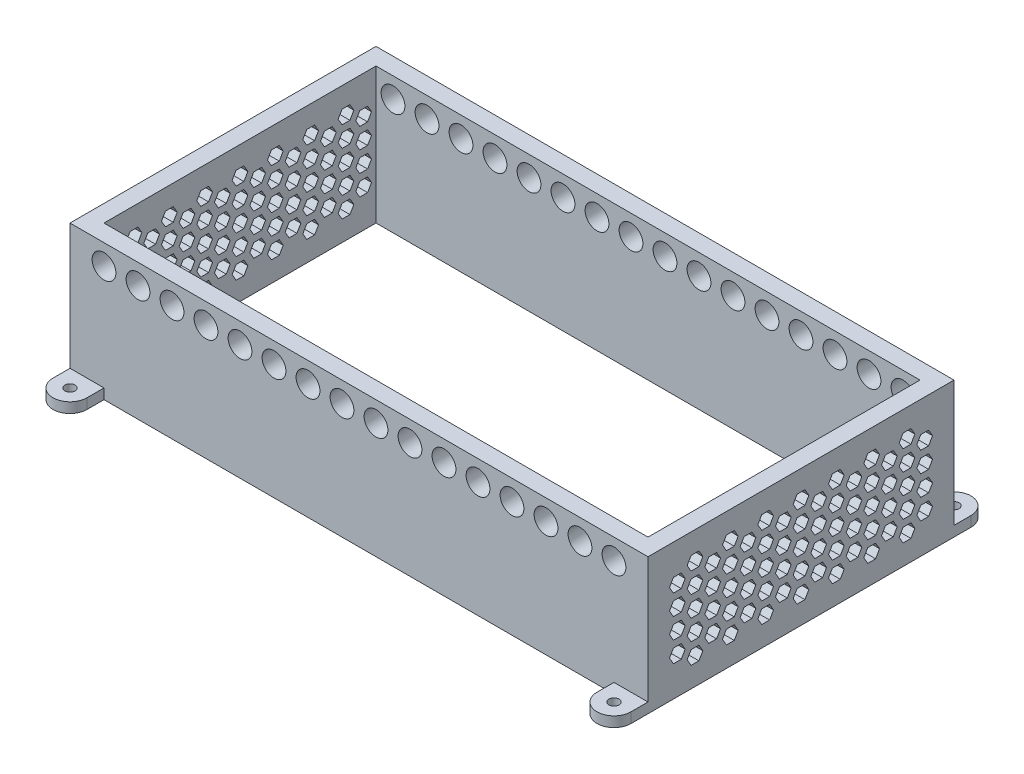
from build123d import *

# Parameters (mm, degrees)
SKETCH1_W           = 170
SKETCH1_H           = 90
BOSS_EXTRUDE1_DEPTH = 40
SHELL1_T            = -5
SKETCH2_R           = 3.5
CUT_EXTRUDE1_DEPTH  = 100
FILL_START          = -85
FILL_PATTERN1_DEPTH = 170
SKETCH4_R           = 5
SKETCH4_W           = 10
SKETCH4_H           = 10
BOSS_EXTRUDE2_DEPTH = 3
SKETCH5_R           = 1.5
CUT_EXTRUDE2_DEPTH  = 4


# Read off the part's stored shape, not the designer's step: Fill Pattern1
with BuildPart() as part:
    # Sketch1 → Boss-Extrude1 (new body)
    with BuildSketch(Plane(origin=(0, 0, 0), x_dir=(1, 0, 0), z_dir=(0, 1, 0))):
        Rectangle(SKETCH1_W, SKETCH1_H)
    extrude(amount=BOSS_EXTRUDE1_DEPTH)

    # Shell1
    shell1_openings = [part.faces().sort_by_distance(p)[0] for p in [
        (0, 40, 0),
        (0, 0, 0),
    ]]
    offset(amount=SHELL1_T, openings=shell1_openings, kind=Kind.INTERSECTION)

    # Sketch2 → Cut-Extrude1 (cut)
    with BuildSketch(Plane.XY.offset(45)):
        with Locations((-75, 34)):
            Circle(SKETCH2_R)
        with Locations((-65, 34)):
            Circle(SKETCH2_R)
        with Locations((-55, 34)):
            Circle(SKETCH2_R)
        with Locations((-45, 34)):
            Circle(SKETCH2_R)
        with Locations((-35, 34)):
            Circle(SKETCH2_R)
        with Locations((-25, 34)):
            Circle(SKETCH2_R)
        with Locations((-15, 34)):
            Circle(SKETCH2_R)
        with Locations((-5, 34)):
            Circle(SKETCH2_R)
        with Locations((5, 34)):
            Circle(SKETCH2_R)
        with Locations((15, 34)):
            Circle(SKETCH2_R)
        with Locations((25, 34)):
            Circle(SKETCH2_R)
        with Locations((35, 34)):
            Circle(SKETCH2_R)
        with Locations((45, 34)):
            Circle(SKETCH2_R)
        with Locations((55, 34)):
            Circle(SKETCH2_R)
        with Locations((65, 34)):
            Circle(SKETCH2_R)
        with Locations((75, 34)):
            Circle(SKETCH2_R)
    extrude(amount=-CUT_EXTRUDE1_DEPTH, mode=Mode.SUBTRACT)

    # Fill Pattern1 outline → Fill Pattern1 (cut)
    with BuildSketch(Plane.YZ.offset(FILL_START)):
        Polygon((8, 33.486315613), (6, 32.331615075), (6, 30.022213998), (8, 28.867513459), (10, 30.022213998), (10, 32.331615075), align=None)
        Polygon((17, 38.682468036), (15, 37.527767497), (15, 35.218366421), (17, 34.063665882), (19, 35.218366421), (19, 37.527767497), align=None)
        Polygon((6, 21.939310229), (6, 19.629909152), (8, 18.475208614), (10, 19.629909152), (10, 21.939310229), (8, 23.094010768), align=None)
        Polygon((6, 11.547005384), (6, 9.237604307), (8, 8.082903769), (10, 9.237604307), (10, 11.547005384), (8, 12.701705922), align=None)
        Polygon((6, 1.154700538), (6, -1.154700538), (8, -2.309401077), (10, -1.154700538), (10, 1.154700538), (8, 2.309401077), align=None)
        Polygon((6, -9.237604307), (6, -11.547005384), (8, -12.701705922), (10, -11.547005384), (10, -9.237604307), (8, -8.082903769), align=None)
        Polygon((6, -19.629909152), (6, -21.939310229), (8, -23.094010768), (10, -21.939310229), (10, -19.629909152), (8, -18.475208614), align=None)
        Polygon((6, -30.022213998), (6, -32.331615075), (8, -33.486315613), (10, -32.331615075), (10, -30.022213998), (8, -28.867513459), align=None)
        Polygon((15, 24.826061575), (17, 23.671361037), (19, 24.826061575), (19, 27.135462652), (17, 28.29016319), (15, 27.135462652), align=None)
        Polygon((24, 19.629909152), (26, 18.475208614), (28, 19.629909152), (28, 21.939310229), (26, 23.094010768), (24, 21.939310229), align=None)
        Polygon((32, 12.701705922), (30, 11.547005384), (30, 9.237604307), (32, 8.082903769), (34, 9.237604307), (34, 11.547005384), align=None)
        Polygon((14, 2.309401077), (12, 1.154700538), (12, -1.154700538), (14, -2.309401077), (16, -1.154700538), (16, 1.154700538), align=None)
        Polygon((23, 7.505553499), (21, 6.350852961), (21, 4.041451884), (23, 2.886751346), (25, 4.041451884), (25, 6.350852961), align=None)
        Polygon((30, 21.939310229), (30, 19.629909152), (32, 18.475208614), (34, 19.629909152), (34, 21.939310229), (32, 23.094010768), align=None)
        Polygon((30, -30.022213998), (30, -32.331615075), (32, -33.486315613), (34, -32.331615075), (34, -30.022213998), (32, -28.867513459), align=None)
        Polygon((30, -9.237604307), (30, -11.547005384), (32, -12.701705922), (34, -11.547005384), (34, -9.237604307), (32, -8.082903769), align=None)
        Polygon((30, 1.154700538), (30, -1.154700538), (32, -2.309401077), (34, -1.154700538), (34, 1.154700538), (32, 2.309401077), align=None)
        Polygon((30, 32.331615075), (30, 30.022213998), (32, 28.867513459), (34, 30.022213998), (34, 32.331615075), (32, 33.486315613), align=None)
        Polygon((30, -19.629909152), (30, -21.939310229), (32, -23.094010768), (34, -21.939310229), (34, -19.629909152), (32, -18.475208614), align=None)
        Polygon((12, 19.629909152), (14, 18.475208614), (16, 19.629909152), (16, 21.939310229), (14, 23.094010768), (12, 21.939310229), align=None)
        Polygon((21, 14.43375673), (23, 13.279056191), (25, 14.43375673), (25, 16.743157806), (23, 17.897858345), (21, 16.743157806), align=None)
        Polygon((14, 12.701705922), (12, 11.547005384), (12, 9.237604307), (14, 8.082903769), (16, 9.237604307), (16, 11.547005384), align=None)
        Polygon((12, 30.022213998), (14, 28.867513459), (16, 30.022213998), (16, 32.331615075), (14, 33.486315613), (12, 32.331615075), align=None)
        Polygon((21, 24.826061575), (23, 23.671361037), (25, 24.826061575), (25, 27.135462652), (23, 28.29016319), (21, 27.135462652), align=None)
        Polygon((23, -34.063665882), (21, -35.218366421), (21, -37.527767497), (23, -38.682468036), (25, -37.527767497), (25, -35.218366421), align=None)
        Polygon((21, -27.135462652), (23, -28.29016319), (25, -27.135462652), (25, -24.826061575), (23, -23.671361037), (21, -24.826061575), align=None)
        Polygon((12, -21.939310229), (14, -23.094010768), (16, -21.939310229), (16, -19.629909152), (14, -18.475208614), (12, -19.629909152), align=None)
        Polygon((23, 38.682468036), (21, 37.527767497), (21, 35.218366421), (23, 34.063665882), (25, 35.218366421), (25, 37.527767497), align=None)
        Polygon((12, -30.022213998), (12, -32.331615075), (14, -33.486315613), (16, -32.331615075), (16, -30.022213998), (14, -28.867513459), align=None)
        Polygon((12, -9.237604307), (12, -11.547005384), (14, -12.701705922), (16, -11.547005384), (16, -9.237604307), (14, -8.082903769), align=None)
        Polygon((26, -28.867513459), (24, -30.022213998), (24, -32.331615075), (26, -33.486315613), (28, -32.331615075), (28, -30.022213998), align=None)
        Polygon((17, -34.063665882), (15, -35.218366421), (15, -37.527767497), (17, -38.682468036), (19, -37.527767497), (19, -35.218366421), align=None)
        Polygon((24, 32.331615075), (24, 30.022213998), (26, 28.867513459), (28, 30.022213998), (28, 32.331615075), (26, 33.486315613), align=None)
        Polygon((24, 11.547005384), (24, 9.237604307), (26, 8.082903769), (28, 9.237604307), (28, 11.547005384), (26, 12.701705922), align=None)
        Polygon((24, -9.237604307), (24, -11.547005384), (26, -12.701705922), (28, -11.547005384), (28, -9.237604307), (26, -8.082903769), align=None)
        Polygon((24, 1.154700538), (24, -1.154700538), (26, -2.309401077), (28, -1.154700538), (28, 1.154700538), (26, 2.309401077), align=None)
        Polygon((24, -19.629909152), (24, -21.939310229), (26, -23.094010768), (28, -21.939310229), (28, -19.629909152), (26, -18.475208614), align=None)
        Polygon((15, -27.135462652), (17, -28.29016319), (19, -27.135462652), (19, -24.826061575), (17, -23.671361037), (15, -24.826061575), align=None)
        Polygon((20, -28.867513459), (18, -30.022213998), (18, -32.331615075), (20, -33.486315613), (22, -32.331615075), (22, -30.022213998), align=None)
        Polygon((29, -23.671361037), (27, -24.826061575), (27, -27.135462652), (29, -28.29016319), (31, -27.135462652), (31, -24.826061575), align=None)
        Polygon((11, -34.063665882), (9, -35.218366421), (9, -37.527767497), (11, -38.682468036), (13, -37.527767497), (13, -35.218366421), align=None)
        Polygon((18, -19.629909152), (18, -21.939310229), (20, -23.094010768), (22, -21.939310229), (22, -19.629909152), (20, -18.475208614), align=None)
        Polygon((18, 32.331615075), (18, 30.022213998), (20, 28.867513459), (22, 30.022213998), (22, 32.331615075), (20, 33.486315613), align=None)
        Polygon((18, -9.237604307), (18, -11.547005384), (20, -12.701705922), (22, -11.547005384), (22, -9.237604307), (20, -8.082903769), align=None)
        Polygon((18, 1.154700538), (18, -1.154700538), (20, -2.309401077), (22, -1.154700538), (22, 1.154700538), (20, 2.309401077), align=None)
        Polygon((18, 11.547005384), (18, 9.237604307), (20, 8.082903769), (22, 9.237604307), (22, 11.547005384), (20, 12.701705922), align=None)
        Polygon((18, 21.939310229), (18, 19.629909152), (20, 18.475208614), (22, 19.629909152), (22, 21.939310229), (20, 23.094010768), align=None)
        Polygon((9, -27.135462652), (11, -28.29016319), (13, -27.135462652), (13, -24.826061575), (11, -23.671361037), (9, -24.826061575), align=None)
        Polygon((27, -37.527767497), (29, -38.682468036), (31, -37.527767497), (31, -35.218366421), (29, -34.063665882), (27, -35.218366421), align=None)
        Polygon((29, -13.279056191), (27, -14.43375673), (27, -16.743157806), (29, -17.897858345), (31, -16.743157806), (31, -14.43375673), align=None)
        Polygon((9, -14.43375673), (9, -16.743157806), (11, -17.897858345), (13, -16.743157806), (13, -14.43375673), (11, -13.279056191), align=None)
        Polygon((9, -4.041451884), (9, -6.350852961), (11, -7.505553499), (13, -6.350852961), (13, -4.041451884), (11, -2.886751346), align=None)
        Polygon((9, 6.350852961), (9, 4.041451884), (11, 2.886751346), (13, 4.041451884), (13, 6.350852961), (11, 7.505553499), align=None)
        Polygon((9, 16.743157806), (9, 14.43375673), (11, 13.279056191), (13, 14.43375673), (13, 16.743157806), (11, 17.897858345), align=None)
        Polygon((9, 27.135462652), (9, 24.826061575), (11, 23.671361037), (13, 24.826061575), (13, 27.135462652), (11, 28.29016319), align=None)
        Polygon((9, 37.527767497), (9, 35.218366421), (11, 34.063665882), (13, 35.218366421), (13, 37.527767497), (11, 38.682468036), align=None)
        Polygon((15, -14.43375673), (15, -16.743157806), (17, -17.897858345), (19, -16.743157806), (19, -14.43375673), (17, -13.279056191), align=None)
        Polygon((15, -4.041451884), (15, -6.350852961), (17, -7.505553499), (19, -6.350852961), (19, -4.041451884), (17, -2.886751346), align=None)
        Polygon((15, 6.350852961), (15, 4.041451884), (17, 2.886751346), (19, 4.041451884), (19, 6.350852961), (17, 7.505553499), align=None)
        Polygon((15, 16.743157806), (15, 14.43375673), (17, 13.279056191), (19, 14.43375673), (19, 16.743157806), (17, 17.897858345), align=None)
        Polygon((27, 16.743157806), (27, 14.43375673), (29, 13.279056191), (31, 14.43375673), (31, 16.743157806), (29, 17.897858345), align=None)
        Polygon((27, 6.350852961), (27, 4.041451884), (29, 2.886751346), (31, 4.041451884), (31, 6.350852961), (29, 7.505553499), align=None)
        Polygon((27, 27.135462652), (27, 24.826061575), (29, 23.671361037), (31, 24.826061575), (31, 27.135462652), (29, 28.29016319), align=None)
        Polygon((27, 37.527767497), (27, 35.218366421), (29, 34.063665882), (31, 35.218366421), (31, 37.527767497), (29, 38.682468036), align=None)
        Polygon((27, -4.041451884), (27, -6.350852961), (29, -7.505553499), (31, -6.350852961), (31, -4.041451884), (29, -2.886751346), align=None)
        Polygon((21, -4.041451884), (21, -6.350852961), (23, -7.505553499), (25, -6.350852961), (25, -4.041451884), (23, -2.886751346), align=None)
        Polygon((21, -14.43375673), (21, -16.743157806), (23, -17.897858345), (25, -16.743157806), (25, -14.43375673), (23, -13.279056191), align=None)
    extrude(amount=FILL_PATTERN1_DEPTH, mode=Mode.SUBTRACT)

    # Sketch4 → Boss-Extrude2 (add)
    with BuildSketch(Plane.XZ):
        with Locations((-80, 50)):
            Circle(SKETCH4_R)
        with Locations((80, 50)):
            Circle(SKETCH4_R)
        with Locations((-80, -50)):
            Circle(SKETCH4_R)
        with Locations((80, -50)):
            Circle(SKETCH4_R)
        with Locations((-80, 45)):
            Rectangle(SKETCH4_W, SKETCH4_H)
        with Locations((80, 45)):
            Rectangle(SKETCH4_W, SKETCH4_H)
        with Locations((80, -45)):
            Rectangle(SKETCH4_W, SKETCH4_H)
        with Locations((-80, -45)):
            Rectangle(SKETCH4_W, SKETCH4_H)
    extrude(amount=-BOSS_EXTRUDE2_DEPTH)

    # Sketch5 → Cut-Extrude2 (cut)
    with BuildSketch(Plane(origin=(0, 3, 0), x_dir=(1, 0, 0), z_dir=(0, 1, 0))):
        with Locations(Location((-80, 50, 0), (0, 0, 270))):
            Circle(SKETCH5_R)
        with Locations(Location((80, 50, 0), (0, 0, 270))):
            Circle(SKETCH5_R)
        with Locations(Location((-80, -50, 0), (0, 0, 270))):
            Circle(SKETCH5_R)
        with Locations(Location((80, -50, 0), (0, 0, 270))):
            Circle(SKETCH5_R)
    extrude(amount=-CUT_EXTRUDE2_DEPTH, mode=Mode.SUBTRACT)


solid = part.part
